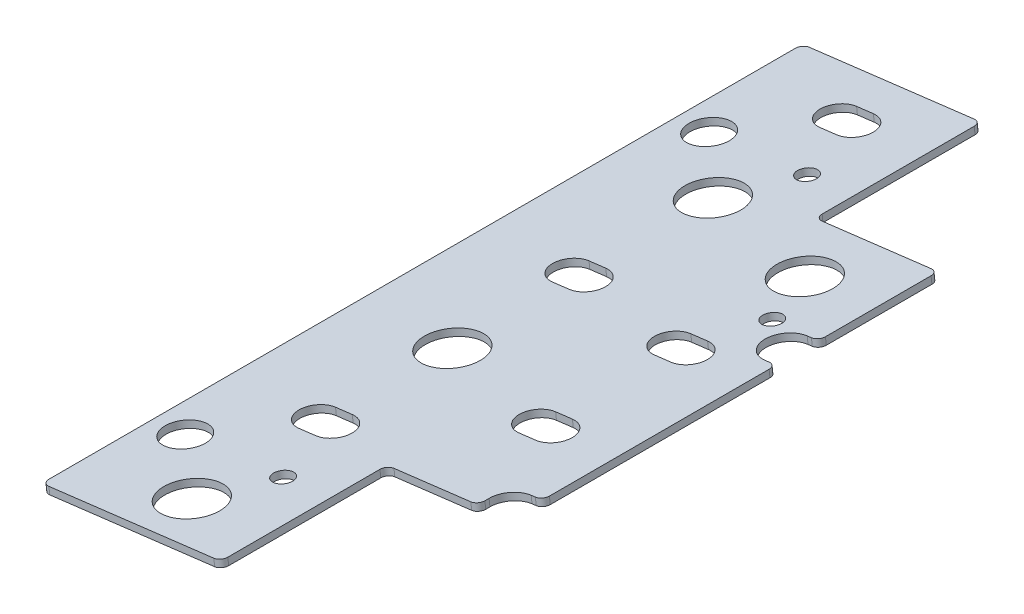
from build123d import *

# Parameters (mm, degrees)
BOSS_EXTRUDE1_DEPTH              = 1.5875
CUT_EXTRUDE1_DEPTH               = 176.834956965
F_1_2_0_5_DIAMETER_HOLE1_D       = 12.7
F_23_64_0_35938_DIAMETER_HOLE1_D = 9.128252
F_6_CLEARANCE_HOLE1_D            = 4.3053
FILLET1_R                        = 1.5875


with BuildPart() as part:
    # Sketch2 → Boss-Extrude1 (new body)
    with BuildSketch(Plane(origin=(15.384044924, -125.292991321, 0), x_dir=(0.992546151641322, 0.12186934340514778, 0), z_dir=(0.12186934340514778, -0.992546151641322, 0))):
        with BuildLine():
            Line((29.810203833, -44.7675), (27.270203833, -44.7675))
            ThreePointArc((27.270203833, -44.7675), (23.902607788, -43.372596045), (22.507703833, -40.005))
            Line((22.507703833, -40.005), (22.507703833, -37.465))
            Line((22.507703833, -37.465), (1.870203833, -37.465))
            Line((1.870203833, -37.465), (1.870203833, 0))
            Line((1.870203833, 0), (-38.769796167, 0))
            Line((-38.769796167, 0), (-38.769796167, -171.45))
            Line((-38.769796167, -171.45), (1.870203833, -171.45))
            Line((1.870203833, -171.45), (1.870203833, -133.985))
            Line((1.870203833, -133.985), (29.810203833, -133.985))
            Line((29.810203833, -133.985), (29.810203833, -106.9975))
            Line((29.810203833, -106.9975), (27.270203833, -106.9975))
            ThreePointArc((27.270203833, -106.9975), (22.507703833, -102.235), (27.270203833, -97.4725))
            Line((27.270203833, -97.4725), (29.810203833, -97.4725))
            Line((29.810203833, -97.4725), (29.810203833, -44.7675))
        make_face()
    extrude(amount=-BOSS_EXTRUDE1_DEPTH)

    # Sketch3 → Cut-Extrude1 (cut, through all)
    with BuildSketch(Plane(origin=(15.384044924, -125.292991321, 0), x_dir=(0.992546151641322, 0.12186934340514778, 0), z_dir=(0.12186934340514778, -0.992546151641322, 0))):
        with BuildLine():
            Line((-14.004796167, -154.6225), (-17.814796167, -154.6225))
            ThreePointArc((-17.814796167, -154.6225), (-21.942296167, -158.75), (-17.814796167, -162.8775))
            Line((-17.814796167, -162.8775), (-14.004796167, -162.8775))
            ThreePointArc((-14.004796167, -162.8775), (-9.877296167, -158.75), (-14.004796167, -154.6225))
        make_face()
        with BuildLine():
            Line((-14.004796167, -94.2975), (-17.814796167, -94.2975))
            ThreePointArc((-17.814796167, -94.2975), (-21.942296167, -98.425), (-17.814796167, -102.5525))
            Line((-17.814796167, -102.5525), (-14.004796167, -102.5525))
            ThreePointArc((-14.004796167, -102.5525), (-9.877296167, -98.425), (-14.004796167, -94.2975))
        make_face()
        with BuildLine():
            Line((-14.004796167, -37.1475), (-17.814796167, -37.1475))
            ThreePointArc((-17.814796167, -37.1475), (-21.942296167, -41.275), (-17.814796167, -45.4025))
            Line((-17.814796167, -45.4025), (-14.004796167, -45.4025))
            ThreePointArc((-14.004796167, -45.4025), (-9.877296167, -41.275), (-14.004796167, -37.1475))
        make_face()
        with BuildLine():
            Line((15.522703833, -87.9475), (11.712703833, -87.9475))
            ThreePointArc((11.712703833, -87.9475), (7.585203833, -92.075), (11.712703833, -96.2025))
            Line((11.712703833, -96.2025), (15.522703833, -96.2025))
            ThreePointArc((15.522703833, -96.2025), (19.650203833, -92.075), (15.522703833, -87.9475))
        make_face()
        with BuildLine():
            Line((15.522703833, -57.4675), (11.712703833, -57.4675))
            ThreePointArc((11.712703833, -57.4675), (7.585203833, -61.595), (11.712703833, -65.7225))
            Line((11.712703833, -65.7225), (15.522703833, -65.7225))
            ThreePointArc((15.522703833, -65.7225), (19.650203833, -61.595), (15.522703833, -57.4675))
        make_face()
    extrude(amount=-CUT_EXTRUDE1_DEPTH, mode=Mode.SUBTRACT)

    # 1/2 (0.5) Diameter Hole1 (through all)
    with Locations(Plane(origin=(15.384044924, -125.292991321, 0), x_dir=(-0.992546151641322, -0.12186934340514778, 0), z_dir=(0.12186934340514778, -0.992546151641322, 0))):
        with Locations((15.909796167, 128.5875), (-13.617703833, 120.015), (15.909796167, 69.85), (15.909796167, 11.1125)):
            Hole(F_1_2_0_5_DIAMETER_HOLE1_D / 2)

    # 23/64 (0.35938) Diameter Hole1 (through all)
    with Locations(Plane(origin=(15.384044924, -125.292991321, 0), x_dir=(-0.992546151641322, -0.12186934340514778, 0), z_dir=(0.12186934340514778, -0.992546151641322, 0))):
        with Locations((31.149796167, 142.875), (31.149796167, 24.765)):
            Hole(F_23_64_0_35938_DIAMETER_HOLE1_D / 2)

    # #6 Clearance Hole1 (through all)
    with Locations(Plane(origin=(15.384044924, -125.292991321, 0), x_dir=(-0.992546151641322, -0.12186934340514778, 0), z_dir=(0.12186934340514778, -0.992546151641322, 0))):
        with Locations((-19.015203833, 107.315), (8.924796167, 142.875), (8.924796167, 24.765)):
            Hole(F_6_CLEARANCE_HOLE1_D / 2)

    # Fillet1
    fillet1_edges = [part.edges().sort_by_distance(p)[0] for p in [
        (44.875314226, -120.872207846, -44.7675),
        (37.627245954, -121.762158726, -37.465),
        (17.14357475, -124.2772373, -37.465),
        (17.14357475, -124.2772373, 0),
        (-23.193500853, -129.230007416, 0),
        (17.14357475, -124.2772373, -171.45),
        (17.14357475, -124.2772373, -133.985),
        (44.875314226, -120.872207846, -133.985),
        (44.875314226, -120.872207846, -106.9975),
        (44.875314226, -120.872207846, -97.4725),
        (-23.193500853, -129.230007416, -171.45),
    ]]
    fillet(fillet1_edges, radius=FILLET1_R)


solid = part.part
